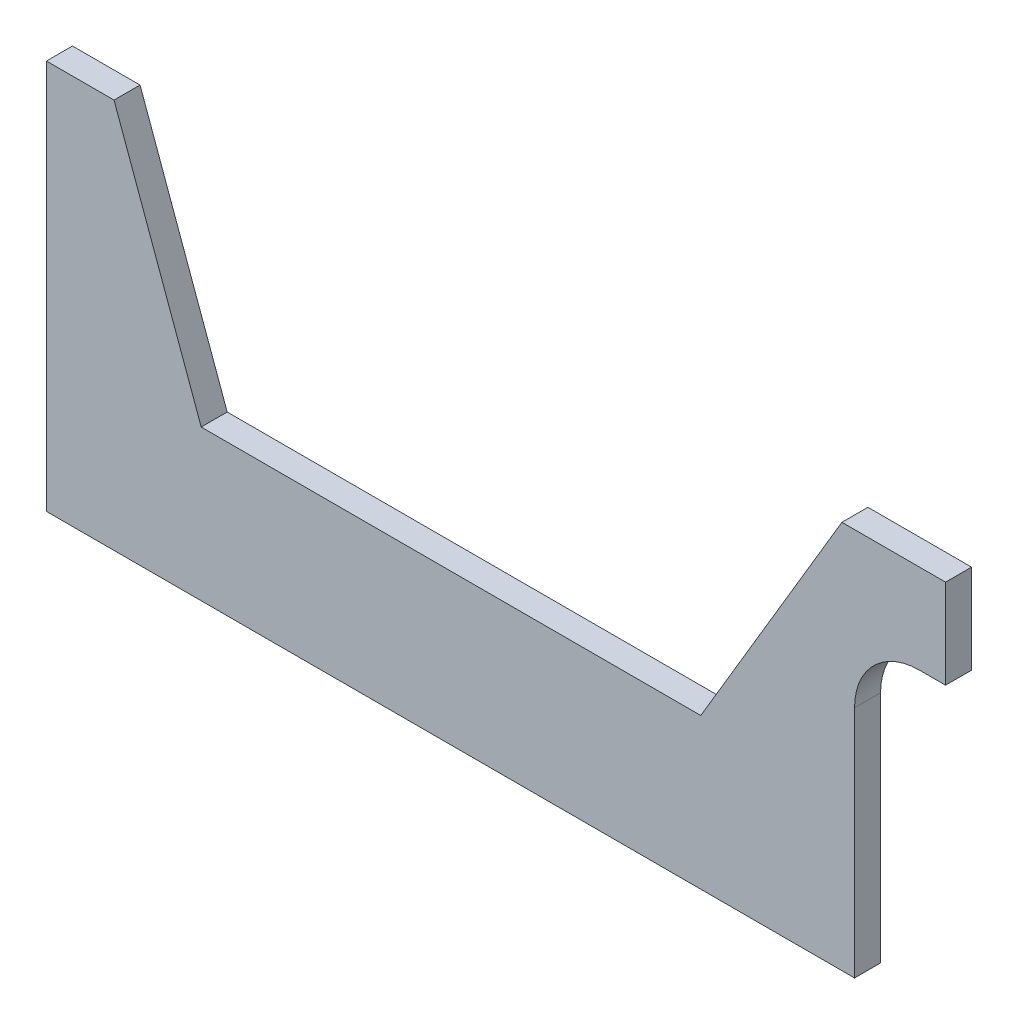
from build123d import *

# Parameters (mm, degrees)
BOSS_EXTRUDE1_DEPTH = 2
FILLET1_R           = 10


with BuildPart() as part:
    # Sketch1 → Boss-Extrude1 (new, symmetric)
    with BuildSketch(Plane.XY):
        Polygon((-60.75, -30), (-60.75, 30), (-50.352877454, 30), (-36.945370579, -6.855179418), (39.897088693, -6.855179418), (61.606830496, 29.73214036), (77.549740604, 29.73214036), (77.549740604, 16), (63.549740604, 16), (63.549740604, -30), align=None)
    extrude(amount=BOSS_EXTRUDE1_DEPTH, both=True)

    # Fillet1
    fillet1_edges = [part.edges().sort_by_distance(p)[0] for p in [
        (63.549740604, 16, 0),
    ]]
    fillet(fillet1_edges, radius=FILLET1_R)


solid = part.part
